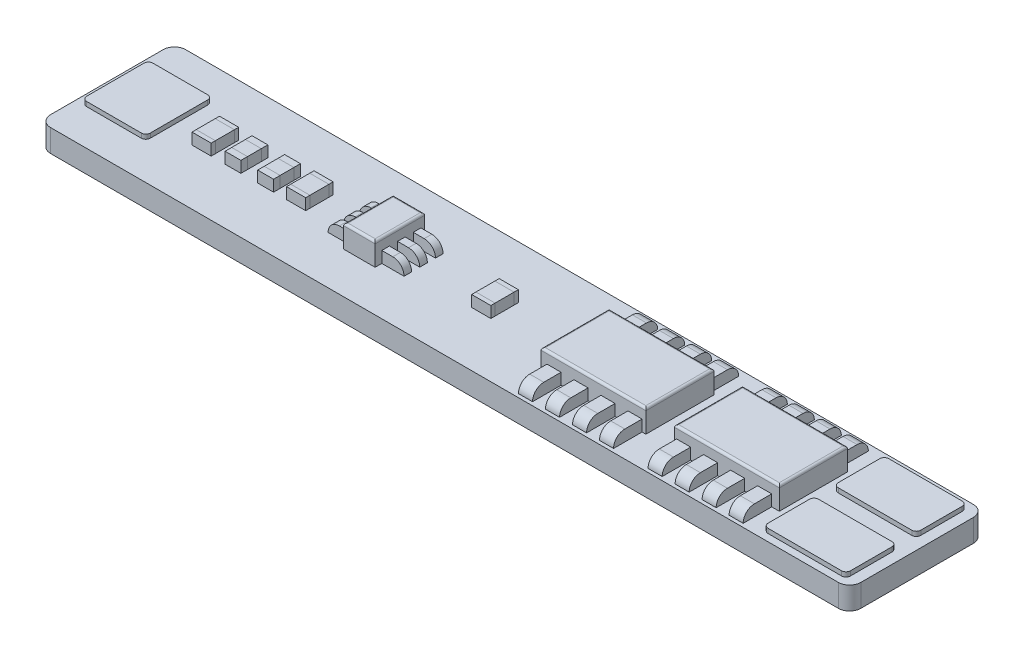
from build123d import *

# Parameters (mm, degrees)
SKETCH1_W             = 36
SKETCH1_H             = 6
BOSS_EXTRUDE1_DEPTH   = 0.5
SKETCH2_W             = 4.661800932
SKETCH2_H             = 3.026509506
SKETCH2_W_2           = 1.401050256
SKETCH2_H_2           = 2.201650402
BOSS_EXTRUDE2_DEPTH   = 1
SKETCH3_W             = 0.625498808
SKETCH3_H             = 1.267451095
SKETCH3_H_2           = 1.267451096
SKETCH3_W_2           = 0.986969007
SKETCH3_H_3           = 0.338448037
SKETCH3_H_4           = 0.338448036
BOSS_EXTRUDE3_DEPTH   = 0.5
CUT_EXTRUDE1_DEPTH    = 12.5
FILLET2_R             = 0.5
BOSS_EXTRUDE4_DEPTH   = 0.2
FILLET3_R             = 0.5
BOSS_EXTRUDE5_DEPTH   = 0.2
FILLET4_R             = 0.1
SKETCH7_W             = 0.851511823
SKETCH7_H             = 0.189006118
SKETCH7_H_2           = 0.189006117
BOSS_EXTRUDE6_DEPTH   = 0.5
SKETCH7_3_W           = 0.851511823
SKETCH7_3_H           = 0.844064918
BOSS_EXTRUDE7_DEPTH   = 0.5
BOSS_EXTRUDE7_2_DEPTH = 0.5
BOSS_EXTRUDE7_3_DEPTH = 0.5
SKETCH8_W             = 0.703276008
SKETCH8_H             = 0.292130035
BOSS_EXTRUDE8_DEPTH   = 0.5
SKETCH8_3_W           = 0.703276008
SKETCH8_3_H           = 0.611309145
SKETCH8_3_H_2         = 0.305654572
SKETCH8_3_H_3         = 0.305654573
BOSS_EXTRUDE9_DEPTH   = 0.5


with BuildPart() as part:
    # Sketch1 → Boss-Extrude1 (new, symmetric)
    with BuildSketch(Plane(origin=(0, 0, 0), x_dir=(1, 0, 0), z_dir=(0, 1, 0))):
        Rectangle(SKETCH1_W, SKETCH1_H)
    extrude(amount=BOSS_EXTRUDE1_DEPTH, both=True)

    # Sketch2 → Boss-Extrude2 (add)
    with BuildSketch(Plane(origin=(0, 0.5, 0), x_dir=(1, 0, 0), z_dir=(0, 1, 0))):
        with Locations((11.122519463, -0.06135285)):
            Rectangle(SKETCH2_W, SKETCH2_H)
        with Locations((5.191537125, -0.06135285)):
            Rectangle(SKETCH2_W, SKETCH2_H)
        with Locations((-5.615414373, -0.066680738)):
            Rectangle(SKETCH2_W_2, SKETCH2_H_2)
    extrude(amount=BOSS_EXTRUDE2_DEPTH)

    # Sketch3 → Boss-Extrude3 (add)
    with BuildSketch(Plane(origin=(0, 0.5, 0), x_dir=(1, 0, 0), z_dir=(0, 1, 0))):
        with Locations((12.800741795, 2.085627451)):
            Rectangle(SKETCH3_W, SKETCH3_H)
        with Locations((11.600741795, 2.085627451)):
            Rectangle(SKETCH3_W, SKETCH3_H)
        with Locations((10.400741795, 2.085627451)):
            Rectangle(SKETCH3_W, SKETCH3_H)
        with Locations((9.200741795, 2.085627451)):
            Rectangle(SKETCH3_W, SKETCH3_H)
        with Locations((9.200741795, -2.208333151)):
            Rectangle(SKETCH3_W, SKETCH3_H_2)
        with Locations((10.400741795, -2.208333151)):
            Rectangle(SKETCH3_W, SKETCH3_H_2)
        with Locations((11.600741795, -2.208333151)):
            Rectangle(SKETCH3_W, SKETCH3_H_2)
        with Locations((12.800741795, -2.208333151)):
            Rectangle(SKETCH3_W, SKETCH3_H_2)
        with Locations((7.041824748, 2.085627451)):
            Rectangle(SKETCH3_W, SKETCH3_H)
        with Locations((5.841824748, 2.085627451)):
            Rectangle(SKETCH3_W, SKETCH3_H)
        with Locations((4.641824748, 2.085627451)):
            Rectangle(SKETCH3_W, SKETCH3_H)
        with Locations((3.441824748, 2.085627451)):
            Rectangle(SKETCH3_W, SKETCH3_H)
        with Locations((3.441824748, -2.208333151)):
            Rectangle(SKETCH3_W, SKETCH3_H_2)
        with Locations((4.641824748, -2.208333151)):
            Rectangle(SKETCH3_W, SKETCH3_H_2)
        with Locations((5.841824748, -2.208333151)):
            Rectangle(SKETCH3_W, SKETCH3_H_2)
        with Locations((7.041824748, -2.208333151)):
            Rectangle(SKETCH3_W, SKETCH3_H_2)
        with Locations((-4.421404741, 0.69667845)):
            Rectangle(SKETCH3_W_2, SKETCH3_H_3)
        with Locations((-4.421404741, -0.001769587)):
            Rectangle(SKETCH3_W_2, SKETCH3_H_4)
        with Locations((-4.421404741, -0.700217623)):
            Rectangle(SKETCH3_W_2, SKETCH3_H_4)
        with Locations((-6.809424005, -0.700217623)):
            Rectangle(SKETCH3_W_2, SKETCH3_H_4)
        with Locations((-6.809424005, -0.001769587)):
            Rectangle(SKETCH3_W_2, SKETCH3_H_4)
        with Locations((-6.809424005, 0.69667845)):
            Rectangle(SKETCH3_W_2, SKETCH3_H_3)
    extrude(amount=BOSS_EXTRUDE3_DEPTH)

    # Sketch4 → Cut-Extrude1 (cut)
    with BuildSketch(Plane(origin=(13.113491199, 0, 0), x_dir=(0, 0, -1), z_dir=(1, 0, 0))):
        with BuildLine():
            Line((-2.342058699, 1), (-2.842058699, 1))
            Line((-2.842058699, 1), (-2.842058699, 0.5))
            ThreePointArc((-2.842058699, 0.5), (-2.69561209, 0.853553391), (-2.342058699, 1))
        make_face()
        with BuildLine():
            Line((2.719352998, 1), (2.719352998, 0.5))
            ThreePointArc((2.719352998, 0.5), (2.572906389, 0.853553391), (2.219352998, 1))
            Line((2.219352998, 1), (2.719352998, 1))
        make_face()
    extrude(amount=-CUT_EXTRUDE1_DEPTH, mode=Mode.SUBTRACT)

    # Fillet2
    fillet2_edges = [part.edges().sort_by_distance(p)[0] for p in [
        (-3.927920238, 1, 0.001769587),
        (-3.927920238, 1, -0.696678449),
        (-7.302908508, 1, -0.696678449),
        (-7.302908508, 1, 0.001769587),
        (-7.302908508, 1, 0.700217623),
        (-3.927920238, 1, 0.700217623),
    ]]
    fillet(fillet2_edges, radius=FILLET2_R - 0.0001)  # a hair under: the kernel refuses the full size

    # Sketch5 → Boss-Extrude4 (add)
    with BuildSketch(Plane(origin=(0, 0.5, 0), x_dir=(1, 0, 0), z_dir=(0, 1, 0))):
        with BuildLine():
            Line((14.060012753, 2.681362157), (17.322933773, 2.681362157))
            ThreePointArc((17.322933773, 2.681362157), (17.464355129, 2.622783513), (17.522933773, 2.481362157))
            Line((17.522933773, 2.481362157), (17.522933773, 0.639574429))
            ThreePointArc((17.522933773, 0.639574429), (17.464355129, 0.498153073), (17.322933773, 0.439574429))
            Line((17.322933773, 0.439574429), (14.060012753, 0.439574429))
            ThreePointArc((14.060012753, 0.439574429), (13.918591397, 0.498153073), (13.860012753, 0.639574429))
            Line((13.860012753, 0.639574429), (13.860012753, 2.481362157))
            ThreePointArc((13.860012753, 2.481362157), (13.918591397, 2.622783513), (14.060012753, 2.681362157))
        make_face()
        with BuildLine():
            Line((17.522933773, -2.481362157), (17.522933773, -0.639574429))
            ThreePointArc((17.522933773, -0.639574429), (17.464355129, -0.498153073), (17.322933773, -0.439574429))
            Line((17.322933773, -0.439574429), (14.060012753, -0.439574429))
            ThreePointArc((14.060012753, -0.439574429), (13.918591397, -0.498153073), (13.860012753, -0.639574429))
            Line((13.860012753, -0.639574429), (13.860012753, -2.481362157))
            ThreePointArc((13.860012753, -2.481362157), (13.918591397, -2.622783513), (14.060012753, -2.681362157))
            Line((14.060012753, -2.681362157), (17.322933773, -2.681362157))
            ThreePointArc((17.322933773, -2.681362157), (17.464355129, -2.622783513), (17.522933773, -2.481362157))
        make_face()
        with BuildLine():
            Line((-17.507556773, 1.552451082), (-15.077442133, 1.552451082))
            ThreePointArc((-15.077442133, 1.552451082), (-14.936020777, 1.493872438), (-14.877442133, 1.352451082))
            Line((-14.877442133, 1.352451082), (-14.877442133, -1.19396964))
            ThreePointArc((-14.877442133, -1.19396964), (-14.936020777, -1.335390996), (-15.077442133, -1.39396964))
            Line((-15.077442133, -1.39396964), (-17.507556773, -1.39396964))
            ThreePointArc((-17.507556773, -1.39396964), (-17.648978129, -1.335390996), (-17.707556773, -1.19396964))
            Line((-17.707556773, -1.19396964), (-17.707556773, 1.352451082))
            ThreePointArc((-17.707556773, 1.352451082), (-17.648978129, 1.493872438), (-17.507556773, 1.552451082))
        make_face()
    boss_extrude4 = extrude(amount=BOSS_EXTRUDE4_DEPTH)

    # Fillet3
    fillet3_edges = [part.edges().sort_by_distance(p)[0] for p in [
        (-18, 0, -3),
        (18, 0, -3),
        (18, 0, 3),
        (-18, 0, 3),
    ]]
    fillet(fillet3_edges, radius=FILLET3_R)

    # Mirror1: Boss-Extrude4 across plane
    add(boss_extrude4.mirror(Plane.ZX))

    # Sketch6 → Boss-Extrude5 (add)
    with BuildSketch(Plane.XZ.offset(0.5)):
        with BuildLine():
            Line((-8.807781399, 2.664830855), (-6.924589556, 2.664830855))
            ThreePointArc((-6.924589556, 2.664830855), (-5.798037292, 1.538278591), (-6.924589556, 0.411726327))
            Line((-6.924589556, 0.411726327), (-8.807781399, 0.411726327))
            ThreePointArc((-8.807781399, 0.411726327), (-9.934333663, 1.538278591), (-8.807781399, 2.664830855))
        make_face()
        with BuildLine():
            Line((-8.807781399, -2.664830855), (-6.924589556, -2.664830855))
            ThreePointArc((-6.924589556, -2.664830855), (-5.798037292, -1.538278591), (-6.924589556, -0.411726327))
            Line((-6.924589556, -0.411726327), (-8.807781399, -0.411726327))
            ThreePointArc((-8.807781399, -0.411726327), (-9.934333663, -1.538278591), (-8.807781399, -2.664830855))
        make_face()
    extrude(amount=BOSS_EXTRUDE5_DEPTH)

    # Fillet4
    fillet4_edges = [part.edges().sort_by_distance(p)[0] for p in [
        (8.791618997, 1.5, 0.06135285),
        (11.122519463, 1.5, 1.574607603),
        (13.453419929, 1.5, 0.06135285),
        (11.122519463, 1.5, -1.451901903),
        (2.860636659, 1.5, 0.06135285),
        (5.191537125, 1.5, 1.574607603),
        (7.522437591, 1.5, 0.06135285),
        (5.191537125, 1.5, -1.451901903),
        (-6.315939501, 1.5, 0.066680738),
        (-5.615414373, 1.5, 1.167505939),
        (-4.914889245, 1.5, 0.066680738),
        (-5.615414373, 1.5, -1.034144463),
    ]]
    fillet(fillet4_edges, radius=FILLET4_R)

    # Sketch7 → Boss-Extrude6 (add)
    with BuildSketch(Plane(origin=(0, 0.5, 0), x_dir=(1, 0, 0), z_dir=(0, 1, 0))):
        with Locations((-0.799118222, -0.473072047)):
            Rectangle(SKETCH7_W, SKETCH7_H)
        with Locations((-0.799118222, 0.559998989)):
            Rectangle(SKETCH7_W, SKETCH7_H_2)
        with Locations((-9.06209313, -0.43714607)):
            Rectangle(SKETCH7_W, SKETCH7_H_2)
        with Locations((-9.06209313, 0.595924966)):
            Rectangle(SKETCH7_W, SKETCH7_H)
        with Locations((-13.26209313, -0.43714607)):
            Rectangle(SKETCH7_W, SKETCH7_H_2)
        with Locations((-13.26209313, 0.595924966)):
            Rectangle(SKETCH7_W, SKETCH7_H)
    extrude(amount=BOSS_EXTRUDE6_DEPTH)

    # Sketch8 → Boss-Extrude8 (add)
    with BuildSketch(Plane(origin=(0, 0.5, 0), x_dir=(1, 0, 0), z_dir=(0, 1, 0))):
        with Locations((-10.414097174, -0.38760411)):
            Rectangle(SKETCH8_W, SKETCH8_H)
        with Locations((-11.862634718, -0.38760411)):
            Rectangle(SKETCH8_W, SKETCH8_H)
        with Locations((-11.862634718, 0.51583507)):
            Rectangle(SKETCH8_W, SKETCH8_H)
        with Locations((-10.414097174, 0.51583507)):
            Rectangle(SKETCH8_W, SKETCH8_H)
    extrude(amount=BOSS_EXTRUDE8_DEPTH)


with BuildPart() as body_2:
    # Sketch7<3> → Boss-Extrude7 (new body)
    with BuildSketch(Plane(origin=(0, 0.5, 0), x_dir=(1, 0, 0), z_dir=(0, 1, 0))):
        with Locations((-0.799118222, 0.043463471)):
            Rectangle(SKETCH7_3_W, SKETCH7_3_H)
    extrude(amount=BOSS_EXTRUDE7_DEPTH)


with BuildPart() as body_3:
    # Sketch7<3> → Boss-Extrude7 2 (new body)
    with BuildSketch(Plane(origin=(0, 0.5, 0), x_dir=(1, 0, 0), z_dir=(0, 1, 0))):
        with Locations((-9.06209313, 0.079389448)):
            Rectangle(SKETCH7_3_W, SKETCH7_3_H)
    extrude(amount=BOSS_EXTRUDE7_2_DEPTH)


with BuildPart() as body_4:
    # Sketch7<3> → Boss-Extrude7 3 (new body)
    with BuildSketch(Plane(origin=(0, 0.5, 0), x_dir=(1, 0, 0), z_dir=(0, 1, 0))):
        with Locations((-13.26209313, 0.079389448)):
            Rectangle(SKETCH7_3_W, SKETCH7_3_H)
    extrude(amount=BOSS_EXTRUDE7_3_DEPTH)


with BuildPart() as body_5:
    # Sketch8<3> → Boss-Extrude9 (new body)
    with BuildSketch(Plane(origin=(0, 0.5, 0), x_dir=(1, 0, 0), z_dir=(0, 1, 0))):
        with Locations((-11.862634718, 0.06411548)):
            Rectangle(SKETCH8_3_W, SKETCH8_3_H)
        with Locations((-10.414097174, 0.216942766)):
            Rectangle(SKETCH8_3_W, SKETCH8_3_H_2)
        with Locations((-10.414097174, -0.088711807)):
            Rectangle(SKETCH8_3_W, SKETCH8_3_H_3)
    extrude(amount=BOSS_EXTRUDE9_DEPTH)


solid = Compound([part.part, body_2.part, body_3.part, body_4.part, body_5.part])
